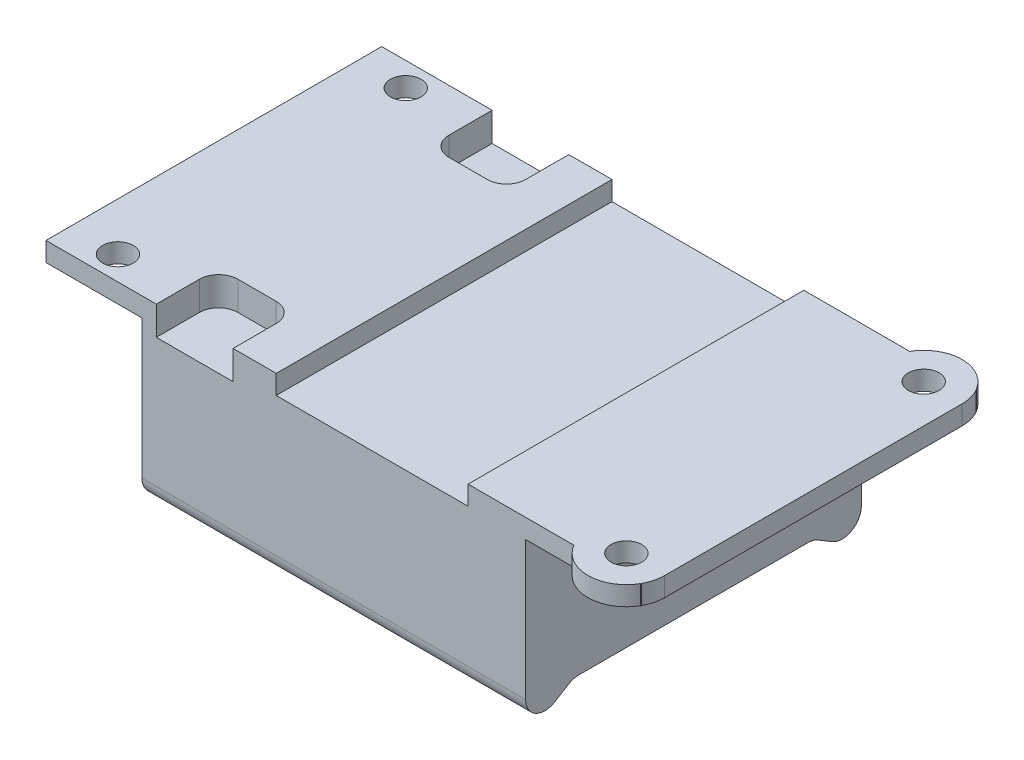
from build123d import *

# Parameters (mm, degrees)
SKETCH1_W               = 40
SKETCH1_H               = 35
BOSS_EXTRUDE1_DEPTH     = 20
CUT_EXTRUDE1_DEPTH      = 49.023431781
CUT_EXTRUDE1_DEPTH_BACK = 49.023431781
FILLET1_R               = 2
SKETCH4_W               = 35
SKETCH4_H               = 2
BOSS_EXTRUDE2_DEPTH     = 10
SKETCH5_W               = 35
SKETCH5_H               = 2
BOSS_EXTRUDE3_DEPTH     = 12
SKETCH6_R               = 1.6
CUT_EXTRUDE2_DEPTH      = 10
SKETCH7_W               = 8
SKETCH7_H               = 6.5
CUT_EXTRUDE3_DEPTH      = 3
SKETCH8_W               = 20
SKETCH8_H               = 2
CUT_EXTRUDE5_DEPTH      = 51.892562919
FILLET2_R               = 2
SKETCH10_R              = 1.6
CUT_EXTRUDE6_DEPTH      = 41.017902038
BOSS_EXTRUDE4_DEPTH     = 2


with BuildPart() as part:
    # Sketch1 → Boss-Extrude1 (new body)
    with BuildSketch(Plane(origin=(0, 0, 0), x_dir=(1, 0, 0), z_dir=(0, 1, 0))):
        Rectangle(SKETCH1_W, SKETCH1_H)
    extrude(amount=-BOSS_EXTRUDE1_DEPTH)

    # Sketch2 → Cut-Extrude1 (cut, two sides: drawn at the far end of the back side and taken through both)
    with BuildSketch(Plane(origin=(20, 0, 0), x_dir=(0, 0, -1), z_dir=(1, 0, 0)).offset(-CUT_EXTRUDE1_DEPTH_BACK)):
        Polygon((-12.5, -17), (-17.5, -20), (17.5, -20), (12.5, -17), align=None)
    extrude(amount=CUT_EXTRUDE1_DEPTH + CUT_EXTRUDE1_DEPTH_BACK, mode=Mode.SUBTRACT)

    # Fillet1
    fillet1_edges = [part.edges().sort_by_distance(p)[0] for p in [
        (0, -17, 12.5),
        (0, -17, -12.5),
        (0, -20, -17.5),
        (0, -20, 17.5),
    ]]
    fillet(fillet1_edges, radius=FILLET1_R)

    # Sketch4 → Boss-Extrude2 (add)
    with BuildSketch(Plane.ZY.offset(20)):
        with Locations((0, -1)):
            Rectangle(SKETCH4_W, SKETCH4_H)
    extrude(amount=BOSS_EXTRUDE2_DEPTH)

    # Sketch5 → Boss-Extrude3 (add)
    with BuildSketch(Plane(origin=(20, 0, 0), x_dir=(0, 0, -1), z_dir=(1, 0, 0))):
        with Locations((0, -1)):
            Rectangle(SKETCH5_W, SKETCH5_H)
    extrude(amount=BOSS_EXTRUDE3_DEPTH)

    # Sketch6 → Cut-Extrude2 (cut)
    with BuildSketch(Plane.XZ.offset(2)):
        with Locations((-25, 15)):
            Circle(SKETCH6_R)
        with Locations((-25, -15)):
            Circle(SKETCH6_R)
    extrude(amount=-CUT_EXTRUDE2_DEPTH, mode=Mode.SUBTRACT)

    # Sketch7 → Cut-Extrude3 (cut)
    with BuildSketch(Plane(origin=(0, 0, 0), x_dir=(1, 0, 0), z_dir=(0, 1, 0))):
        Polygon((-18.5, -19), (-10.5, -19), (-10.5, -11), (-18.5, -11), (-18.5, -15), align=None)
        with Locations((-14.5, 14.25)):
            Rectangle(SKETCH7_W, SKETCH7_H)
    extrude(amount=-CUT_EXTRUDE3_DEPTH, mode=Mode.SUBTRACT)

    # Sketch8 → Cut-Extrude5 (cut, through all)
    with BuildSketch(Plane.XY.offset(17.5)):
        with Locations((4, -1)):
            Rectangle(SKETCH8_W, SKETCH8_H)
    extrude(amount=-CUT_EXTRUDE5_DEPTH, mode=Mode.SUBTRACT)

    # Fillet2
    fillet2_edges = [part.edges().sort_by_distance(p)[0] for p in [
        (-18.5, -1.5, 11),
        (-10.5, -1.5, 11),
        (-18.5, -1.5, -11),
        (-10.5, -1.5, -11),
    ]]
    fillet(fillet2_edges, radius=FILLET2_R)

    # Sketch10 → Cut-Extrude6 (cut, through all)
    with BuildSketch(Plane.XZ.offset(2)):
        with Locations((28.5, 15.5)):
            Circle(SKETCH10_R)
        with Locations((28.5, -15.5)):
            Circle(SKETCH10_R)
    extrude(amount=-CUT_EXTRUDE6_DEPTH, mode=Mode.SUBTRACT)

    # Sketch10<4> → Boss-Extrude4 (add)
    with BuildSketch(Plane.XZ.offset(2)):
        with BuildLine():
            Line((32.5, -15.5), (32.5, 15.5))
            ThreePointArc((32.5, 15.5), (32.372983346, 16.5), (32, 17.436491673))
            Line((32, 17.436491673), (32, -17.436491673))
            ThreePointArc((32, -17.436491673), (32.372983346, -16.5), (32.5, -15.5))
        make_face()
        with BuildLine():
            Line((31.964101615, -17.5), (25.035898385, -17.5))
            ThreePointArc((25.035898385, -17.5), (28.5, -19.5), (31.964101615, -17.5))
        make_face()
        with BuildLine():
            ThreePointArc((31.964101615, 17.5), (28.5, 19.5), (25.035898385, 17.5))
            Line((25.035898385, 17.5), (31.964101615, 17.5))
        make_face()
    extrude(amount=-BOSS_EXTRUDE4_DEPTH)


solid = part.part
